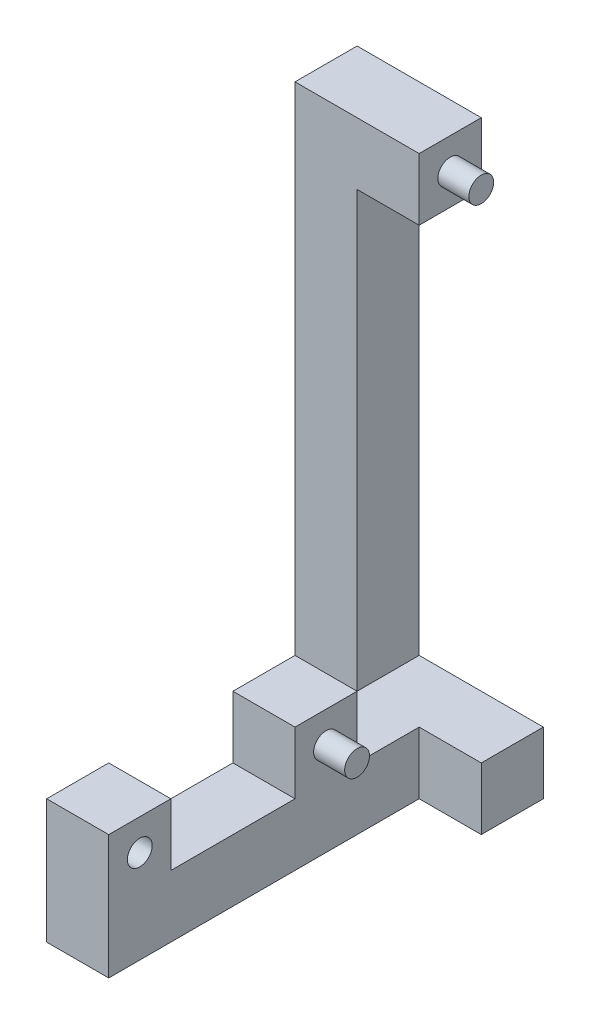
from build123d import *

# Parameters (mm, degrees)
LOWERBASE_W             = 200
LOWERBASE_H             = 200
BOSS_EXTRUDE1_DEPTH     = 200
UPPERBASE_W             = 200
UPPERBASE_H             = 1800
BOSS_EXTRUDE2_DEPTH     = 200
TOPPIVOT_W              = 200
TOPPIVOT_H              = 200
BOSS_EXTRUDE3_DEPTH     = 200
PRESSTABLE_W            = 200
PRESSTABLE_H            = 200
BOSS_EXTRUDE4_DEPTH     = 400
MIDDLERIVET_R           = 40
BOSS_EXTRUDE5_DEPTH     = 300
TOPRIVET_R              = 40
BOSS_EXTRUDE6_DEPTH     = 300
CUT_EXTRUDE1_DEPTH      = 2201
CUT_EXTRUDE1_DEPTH_BACK = 2201
SKETCH6_R               = 40


with BuildPart() as part:
    # LowerBase → Boss-Extrude1 (new body)
    with BuildSketch(Plane(origin=(0, 0, 0), x_dir=(0, 0, -1), z_dir=(1, 0, 0))):
        Polygon((-1200, 0), (0, 0), (0, 200), (-400, 200), (-600, 200), (-1000, 200), (-1200, 200), align=None)
        with Locations((-1100, 300)):
            Rectangle(LOWERBASE_W, LOWERBASE_H)
        with Locations((-500, 300)):
            Rectangle(LOWERBASE_W, LOWERBASE_H)
    extrude(amount=BOSS_EXTRUDE1_DEPTH)

    # UpperBase → Boss-Extrude2 (add)
    with BuildSketch(Plane(origin=(0, 0, 0), x_dir=(0, 0, -1), z_dir=(1, 0, 0))):
        with Locations((-100, 900)):
            Rectangle(UPPERBASE_W, UPPERBASE_H)
    extrude(amount=-BOSS_EXTRUDE2_DEPTH)

    # TopPivot → Boss-Extrude3 (add)
    with BuildSketch(Plane(origin=(0, 0, 0), x_dir=(0, 0, -1), z_dir=(1, 0, 0))):
        with Locations((-100, 1700)):
            Rectangle(TOPPIVOT_W, TOPPIVOT_H)
    extrude(amount=BOSS_EXTRUDE3_DEPTH)

    # PressTable → Boss-Extrude4 (add)
    with BuildSketch(Plane(origin=(0, 0, 0), x_dir=(0, 0, -1), z_dir=(1, 0, 0))):
        with Locations((-100, 100)):
            Rectangle(PRESSTABLE_W, PRESSTABLE_H)
    extrude(amount=BOSS_EXTRUDE4_DEPTH)

    # MiddleRivet → Boss-Extrude5 (add)
    with BuildSketch(Plane(origin=(0, 0, 0), x_dir=(0, 0, -1), z_dir=(1, 0, 0))):
        with Locations((-500, 300)):
            Circle(MIDDLERIVET_R)
    extrude(amount=BOSS_EXTRUDE5_DEPTH)

    # TopRivet → Boss-Extrude6 (add)
    with BuildSketch(Plane(origin=(0, 0, 0), x_dir=(0, 0, -1), z_dir=(1, 0, 0))):
        with Locations((-100, 1700)):
            Circle(TOPRIVET_R)
    extrude(amount=BOSS_EXTRUDE6_DEPTH)

    # Sketch6 → Cut-Extrude1 (cut, two sides: drawn at the far end of the back side and taken through both)
    with BuildSketch(Plane(origin=(0, 0, 0), x_dir=(0, 0, -1), z_dir=(1, 0, 0)).offset(-CUT_EXTRUDE1_DEPTH_BACK)):
        with Locations((-1100, 300)):
            Circle(SKETCH6_R)
    extrude(amount=CUT_EXTRUDE1_DEPTH + CUT_EXTRUDE1_DEPTH_BACK, mode=Mode.SUBTRACT)


solid = part.part
